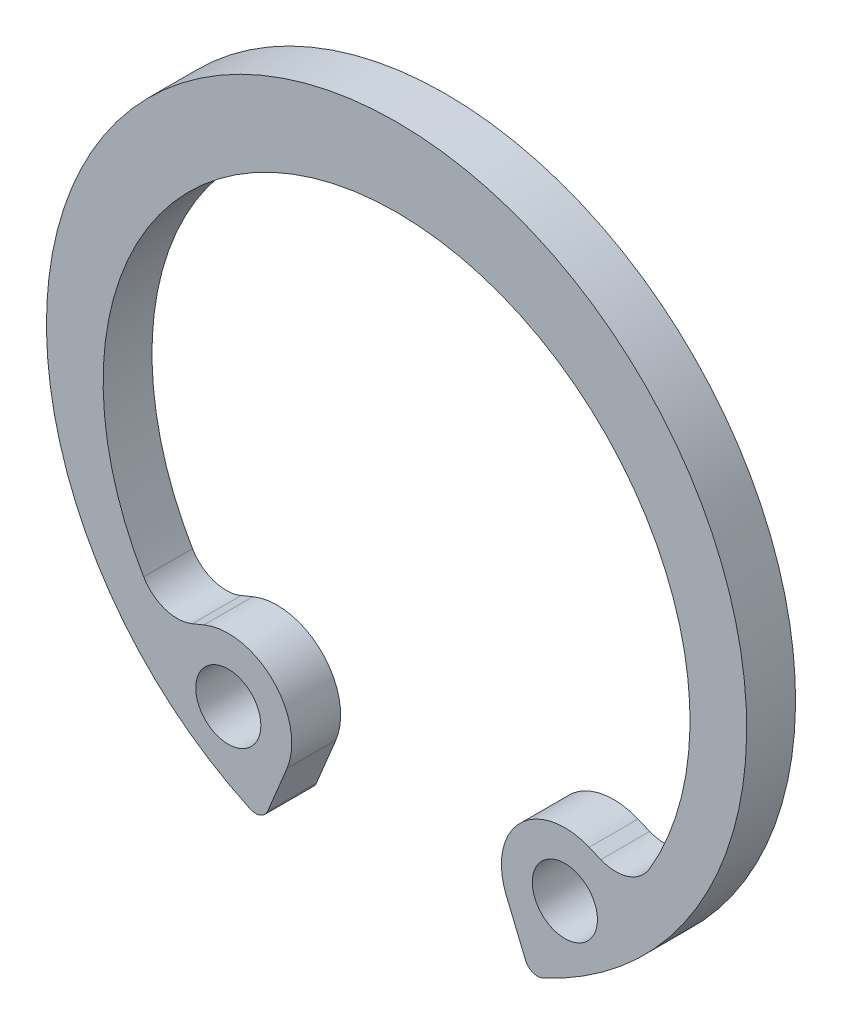
from build123d import *

# Parameters (mm, degrees)
BODYSKE_R      = 1
BASEBODY_DEPTH = 1.5
FILLET1_R      = 1.2
FILLET2_R      = 0.4


with BuildPart() as part:
    # BodySke → BaseBody (new body)
    with BuildSketch(Plane.XY):
        with BuildLine():
            ThreePointArc((5.913228336, -5.580088386), (3.788874734, -6.00264859), (3.36631453, -8.127002192))
            Line((3.36631453, -8.127002192), (4.113846898, -9.931704974))
            ThreePointArc((4.113846898, -9.931704974), (0, 10.75), (-4.113846898, -9.931704974))
            Line((-4.113846898, -9.931704974), (-3.36631453, -8.127002192))
            ThreePointArc((-3.36631453, -8.127002192), (-3.788874734, -6.00264859), (-5.913228336, -5.580088386))
            Line((-5.913228336, -5.580088386), (-7.179036908, -6.104403463))
            ThreePointArc((-7.179036908, -6.104403463), (0, 8.35), (7.179036908, -6.104403463))
            Line((7.179036908, -6.104403463), (5.913228336, -5.580088386))
        make_face()
        with Locations((-5.167254553, -7.381028409)):
            Circle(BODYSKE_R, mode=Mode.SUBTRACT)
        with Locations((5.167254553, -7.381028409)):
            Circle(BODYSKE_R, mode=Mode.SUBTRACT)
    extrude(amount=BASEBODY_DEPTH)

    # Fillet1
    fillet1_edges = [part.edges().sort_by_distance(p)[0] for p in [
        (7.179036908, -6.104403463, 0.75),
        (-7.179036908, -6.104403463, 0.75),
    ]]
    fillet(fillet1_edges, radius=FILLET1_R)

    # Fillet2
    fillet2_edges = [part.edges().sort_by_distance(p)[0] for p in [
        (4.113846898, -9.931704974, 0.75),
        (-4.113846898, -9.931704974, 0.75),
    ]]
    fillet(fillet2_edges, radius=FILLET2_R)


solid = part.part
